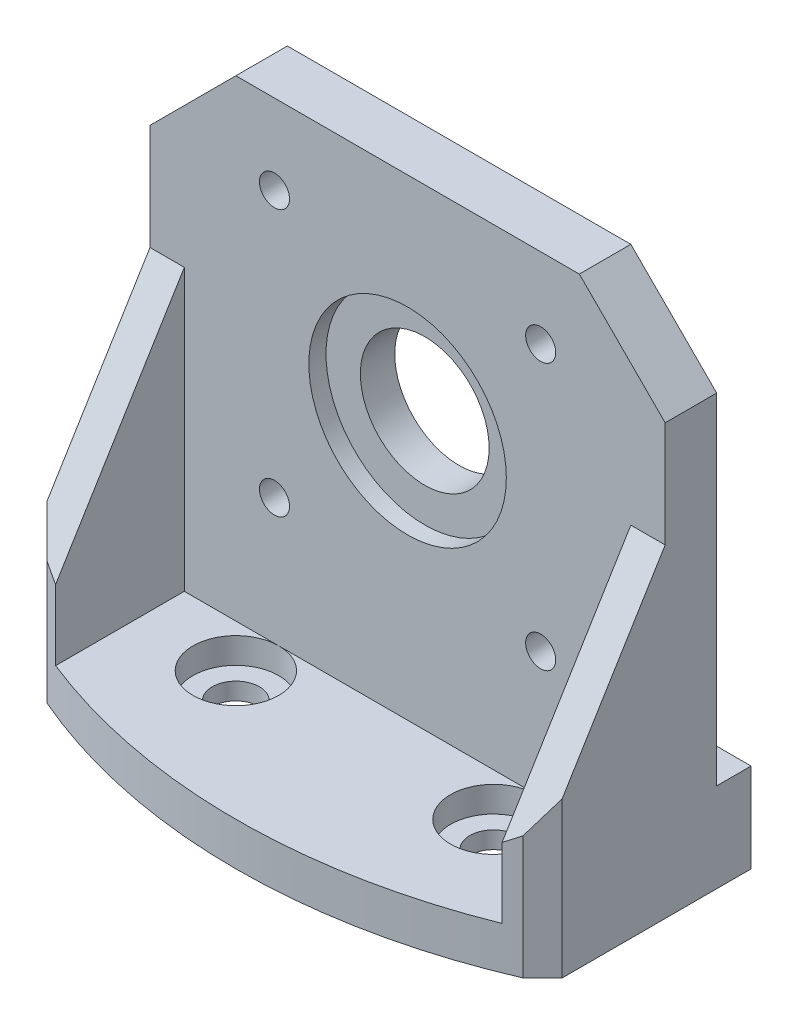
from build123d import *

# Parameters (mm, degrees)
SKETCH1_W                = 120
SKETCH1_H                = 30
BOSS_EXTRUDE1_DEPTH      = 100
SKETCH3_OUTSIDE_W        = 153.812
SKETCH3_OUTSIDE_H        = 133.812
CUT_EXTRUDE2_DEPTH       = 121.415945788
CUT_EXTRUDE3_START       = -30
CUT_EXTRUDE3_DEPTH       = 30
SKETCH5_W                = 67.698745078
SKETCH5_H                = 100.8
CUT_EXTRUDE4_DEPTH       = 20
RIB1_REACH               = 122.416
SKETCH6_WALL_W           = 281.143052644
SKETCH6_WALL_H           = 4
RIB6_REACH               = 122.416
SKETCH7_WALL_W           = 281.143052644
SKETCH7_WALL_H           = 4
CUT_EXTRUDE5_DEPTH       = 84.326168543
CUT_EXTRUDE5_DEPTH_BACK  = 84.326168543
SKETCH9_R                = 2.75
SKETCH10_R               = 5
CUT_EXTRUDE6_DEPTH       = 3
CHAMFER1_SIZE            = 8
CUT_EXTRUDE7_START       = -14.352520936
CUT_EXTRUDE7_DEPTH       = 14.352520936
SKETCH13_W               = 60
SKETCH13_H               = 40
BOSS_EXTRUDE2_DEPTH      = 10
CUT_EXTRUDE8_DEPTH       = 108.204960324
CUT_EXTRUDE8_DEPTH_BACK  = 108.204960324
SKETCH12_R               = 1.75
SKETCH12_R_2             = 7.5
CHAMFER2_SIZE            = 10
SKETCH14_R               = 11.5
CUT_EXTRUDE9_DEPTH       = 1
BOSS_EXTRUDE3_START      = 1
SKETCH16_W               = 42.5
SKETCH16_H               = 42.5
SKETCH16_R               = 1.75
SKETCH16_R_2             = 11.5
BOSS_EXTRUDE3_DEPTH      = 1
SKETCH17_W               = 48.072912132
SKETCH17_H               = 52.974055018
BOSS_EXTRUDE4_DEPTH      = 10
SKETCH17_2_W             = 48.072912132
SKETCH17_2_H             = 52.974055018
CUT_EXTRUDE10_DEPTH      = 108.204960324
CUT_EXTRUDE11_DEPTH      = 108.204960324
CUT_EXTRUDE11_DEPTH_BACK = 108.204960324
SKETCH18_R               = 7.5
SKETCH18_R_2             = 1.75
SKETCH19_R               = 11.5
CUT_EXTRUDE12_DEPTH      = 2
CUT_EXTRUDE13_DEPTH      = 108.204960324
CUT_EXTRUDE13_DEPTH_BACK = 108.204960324
SKETCH20_W               = 88.74197012
SKETCH20_H               = 29.925009901
CHAMFER3_SIZE            = 10
SKETCH22_W               = 69.690835078
SKETCH22_H               = 49.62
CUT_EXTRUDE14_DEPTH      = 4


# Read off the part's stored shape, not the designer's step: Cut-Extrude3, Cut-Extrude7
with BuildPart() as part:
    # Sketch1 → Boss-Extrude1 (new body)
    with BuildSketch(Plane(origin=(0, 0, 0), x_dir=(1, 0, 0), z_dir=(0, 1, 0))):
        with Locations((0, -15)):
            Rectangle(SKETCH1_W, SKETCH1_H)
    extrude(amount=BOSS_EXTRUDE1_DEPTH)

    # Sketch3 outside → Cut-Extrude2 (cut, through all)
    with BuildSketch(Plane.XY.offset(30)):
        with Locations((0, 50)):
            Rectangle(SKETCH3_OUTSIDE_W, SKETCH3_OUTSIDE_H)
        with BuildLine():
            Line((-45, 23.283541889), (45, 23.283541889))
            Line((45, 23.283541889), (19.804596008, 86.568297014))
            ThreePointArc((19.804596008, 86.568297014), (0, 100), (-19.804596008, 86.568297014))
            Line((-19.804596008, 86.568297014), (-45, 23.283541889))
        make_face(mode=Mode.SUBTRACT)
    extrude(amount=-CUT_EXTRUDE2_DEPTH, mode=Mode.SUBTRACT)

    # Cut-Extrude3 outline → Cut-Extrude3 (cut)
    with BuildSketch(Plane.XY.offset(30).offset(CUT_EXTRUDE3_START)):
        Polygon((30, 60.95991045), (30, 23.283541889), (45, 23.283541889), align=None)
        Polygon((-30, 23.283541889), (-30, 60.95991045), (-45, 23.283541889), align=None)
    extrude(amount=CUT_EXTRUDE3_DEPTH, mode=Mode.SUBTRACT)

    # Sketch5 → Cut-Extrude4 (cut)
    with BuildSketch(Plane.XY.offset(30)):
        with Locations((0, 78.683541889)):
            Rectangle(SKETCH5_W, SKETCH5_H)
    extrude(amount=-CUT_EXTRUDE4_DEPTH, mode=Mode.SUBTRACT)

    # Sketch6 wall → Rib1 (add, up to next)
    with BuildSketch(Plane(origin=(-30, 44.62172617, 20), x_dir=(0, -0.852920340981, 0.522041082618), z_dir=(0, 0.522041082618, 0.852920340981)), mode=Mode.PRIVATE) as rib1_sk1:
        with Locations((0, 2)):
            Rectangle(SKETCH6_WALL_W, SKETCH6_WALL_H)
    rib1_tool1 = extrude(rib1_sk1.sketch, amount=-RIB1_REACH, mode=Mode.PRIVATE) - part.part
    add(rib1_tool1.solids().sort_by_distance((-30, 44.62172617, 20))[0])

    # Sketch7 wall → Rib6 (add, up to next)
    with BuildSketch(Plane(origin=(30, 44.62172617, 20), x_dir=(0, -0.852920340981, 0.522041082618), z_dir=(0, -0.522041082618, -0.852920340981)), mode=Mode.PRIVATE) as rib6_sk1:
        with Locations((0, 2)):
            Rectangle(SKETCH7_WALL_W, SKETCH7_WALL_H)
    rib6_tool1 = extrude(rib6_sk1.sketch, amount=RIB6_REACH, mode=Mode.PRIVATE) - part.part
    add(rib6_tool1.solids().sort_by_distance((30, 44.62172617, 20))[0])

    # Sketch9 → Cut-Extrude5 (cut, two sides: drawn at the far end of the back side and taken through both)
    with BuildSketch(Plane(origin=(0, 28.283541889, 0), x_dir=(1, 0, 0), z_dir=(0, 1, 0)).offset(-CUT_EXTRUDE5_DEPTH_BACK)):
        with Locations(Location((-15, -15, 0), (0, 0, 270))):
            Circle(SKETCH9_R)
        with Locations(Location((15, -15, 0), (0, 0, 270))):
            Circle(SKETCH9_R)
    extrude(amount=CUT_EXTRUDE5_DEPTH + CUT_EXTRUDE5_DEPTH_BACK, mode=Mode.SUBTRACT)

    # Sketch10 → Cut-Extrude6 (cut)
    with BuildSketch(Plane(origin=(0, 28.283541889, 0), x_dir=(1, 0, 0), z_dir=(0, 1, 0))):
        with Locations((-15, -15)):
            Circle(SKETCH10_R)
        with Locations((15, -15)):
            Circle(SKETCH10_R)
    extrude(amount=-CUT_EXTRUDE6_DEPTH, mode=Mode.SUBTRACT)

    # Chamfer1
    # the kernel refuses this chamfer: 8 mm, written as the material it takes off along each edge
    with BuildSketch(Plane(origin=(-30, 2.710077985, 30), x_dir=(-0.027495876610586535, 0, -0.9996219169112968), z_dir=(0, 1, 0))) as chamfer1_piece_1:
        Polygon((CHAMFER1_SIZE * 0.999621916911, -CHAMFER1_SIZE * 0.0274958766106), (-CHAMFER1_SIZE * 0.0274958766106, -CHAMFER1_SIZE * 0.999621916911), (0, 0), align=None)
    extrude(amount=46.146927807, mode=Mode.SUBTRACT)
    with BuildSketch(Plane(origin=(30, 48.857005793, 30), x_dir=(-0.9996219169112968, 0, 0.027495876610586487), z_dir=(0, -1, 0))) as chamfer1_piece_2:
        Polygon((CHAMFER1_SIZE * 0.999621916911, CHAMFER1_SIZE * 0.0274958766106), (-CHAMFER1_SIZE * 0.0274958766106, CHAMFER1_SIZE * 0.999621916911), (0, 0), align=None)
    extrude(amount=46.146927807, mode=Mode.SUBTRACT)

    # Cut-Extrude7 outline → Cut-Extrude7 (cut)
    with BuildSketch(Plane.XZ.offset(-23.283541889).offset(CUT_EXTRUDE7_START)):
        with BuildLine():
            ThreePointArc((-27.724333118, 24.275666882), (-14.154563191, 28.553981218), (0, 30))
            Line((0, 30), (-22, 30))
            Line((-22, 30), (-27.724333118, 24.275666882))
        make_face()
        with BuildLine():
            ThreePointArc((0, 30), (14.154563191, 28.553981218), (27.724333118, 24.275666882))
            Line((27.724333118, 24.275666882), (22, 30))
            Line((22, 30), (0, 30))
        make_face()
    extrude(amount=CUT_EXTRUDE7_DEPTH, mode=Mode.SUBTRACT)

    # Sketch13 → Boss-Extrude2 (add)
    with BuildSketch(Plane(origin=(0, 0, 0), x_dir=(-1, 0, 0), z_dir=(0, 0, -1))):
        with Locations((0, 80.95991045)):
            Rectangle(SKETCH13_W, SKETCH13_H)
    extrude(amount=-BOSS_EXTRUDE2_DEPTH)

    # Sketch12 → Cut-Extrude8 (cut, two sides: drawn at the far end of the back side and taken through both)
    with BuildSketch(Plane.XY.offset(10).offset(-CUT_EXTRUDE8_DEPTH_BACK)):
        with Locations((-15.5, 84.083541889)):
            Circle(SKETCH12_R)
        with Locations((15.5, 84.083541889)):
            Circle(SKETCH12_R)
        with Locations((-15.5, 53.083541889)):
            Circle(SKETCH12_R)
        with Locations((15.5, 53.083541889)):
            Circle(SKETCH12_R)
        with Locations((0, 68.583541889)):
            Circle(SKETCH12_R_2)
    extrude(amount=CUT_EXTRUDE8_DEPTH + CUT_EXTRUDE8_DEPTH_BACK, mode=Mode.SUBTRACT)

    # Chamfer2
    chamfer2_edges = [part.edges().sort_by_distance(p)[0] for p in [
        (-30, 100.95991045, 5),
        (30, 100.95991045, 5),
    ]]
    chamfer(chamfer2_edges, length=CHAMFER2_SIZE)

    # Sketch14 → Cut-Extrude9 (cut)
    with BuildSketch(Plane.XY.offset(10)):
        with Locations((0, 68.583541889)):
            Circle(SKETCH14_R)
    extrude(amount=-CUT_EXTRUDE9_DEPTH, mode=Mode.SUBTRACT)

    # Sketch16 → Boss-Extrude3 (add)
    with BuildSketch(Plane.XY.offset(10).offset(BOSS_EXTRUDE3_START)):
        with Locations((0, 68.583541889)):
            Rectangle(SKETCH16_W, SKETCH16_H)
        with Locations((-15.5, 84.083541889)):
            Circle(SKETCH16_R, mode=Mode.SUBTRACT)
        with Locations((15.5, 84.083541889)):
            Circle(SKETCH16_R, mode=Mode.SUBTRACT)
        with Locations((15.5, 53.083541889)):
            Circle(SKETCH16_R, mode=Mode.SUBTRACT)
        with Locations((-15.5, 53.083541889)):
            Circle(SKETCH16_R, mode=Mode.SUBTRACT)
        with Locations((0, 68.583541889)):
            Circle(SKETCH16_R_2, mode=Mode.SUBTRACT)
    extrude(amount=-BOSS_EXTRUDE3_DEPTH)

    # Sketch17 → Boss-Extrude4 (add)
    with BuildSketch(Plane.XY.offset(10)):
        with Locations((0, 67.231428327)):
            Rectangle(SKETCH17_W, SKETCH17_H)
    extrude(amount=-BOSS_EXTRUDE4_DEPTH)

    # Sketch17<2> → Cut-Extrude10 (cut, through all)
    with BuildSketch(Plane.XY.offset(10)):
        with Locations((0, 67.231428327)):
            Rectangle(SKETCH17_2_W, SKETCH17_2_H)
    extrude(amount=CUT_EXTRUDE10_DEPTH, mode=Mode.SUBTRACT)

    # Sketch18 → Cut-Extrude11 (cut, two sides: drawn at the far end of the back side and taken through both)
    with BuildSketch(Plane.XY.offset(10).offset(-CUT_EXTRUDE11_DEPTH_BACK)):
        with Locations((0, 58.473541889)):
            Circle(SKETCH18_R)
        with Locations((-15.5, 73.973541889)):
            Circle(SKETCH18_R_2)
        with Locations((-15.5, 42.973541889)):
            Circle(SKETCH18_R_2)
        with Locations((15.5, 42.973541889)):
            Circle(SKETCH18_R_2)
        with Locations((15.5, 73.973541889)):
            Circle(SKETCH18_R_2)
    extrude(amount=CUT_EXTRUDE11_DEPTH + CUT_EXTRUDE11_DEPTH_BACK, mode=Mode.SUBTRACT)

    # Sketch19 → Cut-Extrude12 (cut)
    with BuildSketch(Plane.XY.offset(10)):
        with Locations((0, 58.473541889)):
            Circle(SKETCH19_R)
    extrude(amount=-CUT_EXTRUDE12_DEPTH, mode=Mode.SUBTRACT)

    # Sketch20 → Cut-Extrude13 (cut, two sides: drawn at the far end of the back side and taken through both)
    with BuildSketch(Plane.XY.offset(10).offset(-CUT_EXTRUDE13_DEPTH_BACK)):
        with Locations((2.815550168, 98.246046839)):
            Rectangle(SKETCH20_W, SKETCH20_H)
    extrude(amount=CUT_EXTRUDE13_DEPTH + CUT_EXTRUDE13_DEPTH_BACK, mode=Mode.SUBTRACT)

    # Chamfer3
    chamfer3_edges = [part.edges().sort_by_distance(p)[0] for p in [
        (30, 83.283541889, 5),
        (-30, 83.283541889, 5),
    ]]
    chamfer(chamfer3_edges, length=CHAMFER3_SIZE)

    # Sketch22 → Cut-Extrude14 (cut)
    with BuildSketch(Plane(origin=(0, 0, 0), x_dir=(-1, 0, 0), z_dir=(0, 0, -1))):
        with Locations((0, 58.473541889)):
            Rectangle(SKETCH22_W, SKETCH22_H)
    extrude(amount=-CUT_EXTRUDE14_DEPTH, mode=Mode.SUBTRACT)


solid = part.part
